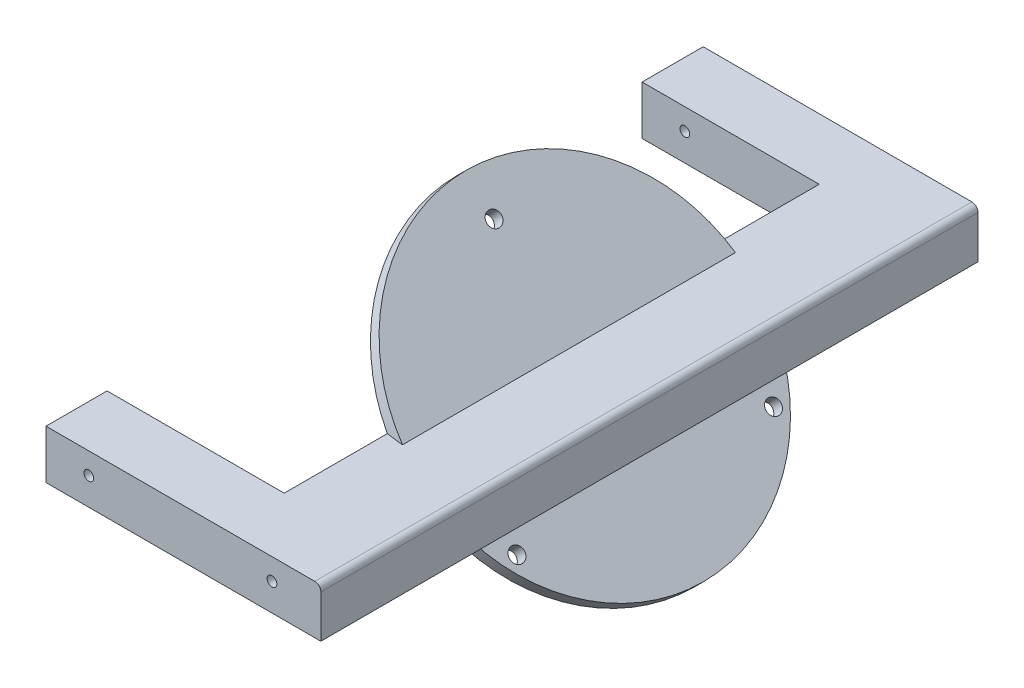
from build123d import *

# Parameters (mm, degrees)
BASE_DEPTH                  = 53.8
SKETCH4_R                   = 27.5
BOSS_EXTRUDE2_DEPTH         = 2
M2_CLEARANCE_HOLE1_D        = 2.4
FILLET1_R                   = 0.5
SIDE_HOLES_D                = 1.6
SIDE_ARM_DEPTH              = 10
TAP_DRILL_FOR_M2X0_4_TAP1_D = 1.6
FILLET2_R                   = 1


with BuildPart() as part:
    # Sketch1 → Base (new, symmetric)
    with BuildSketch(Plane.XY):
        Polygon((8, 4), (-8, 4), (0, -4), (8, -4), align=None)
    extrude(amount=BASE_DEPTH, both=True)

    # Sketch4 → Boss-Extrude2 (add)
    with BuildSketch(Plane(origin=(-2, -2, 0), x_dir=(0, 0, 1), z_dir=(-0.7071067811865475, -0.7071067811865476, 0))):
        with Locations((0, 2.828427125)):
            Circle(SKETCH4_R)
    extrude(amount=-BOSS_EXTRUDE2_DEPTH)

    # M2 Clearance Hole1 (through all)
    with Locations(Plane(origin=(-0.585786438, -0.585786438, 0), x_dir=(0.7071067811865475, -0.7071067811865477, 0), z_dir=(0.7071067811865477, 0.7071067811865475, 0))):
        with Locations((-23.828427125, 0), (11.171572875, 21), (11.171572875, -21)):
            Hole(M2_CLEARANCE_HOLE1_D / 2)

    # Sketch8 → Revolve1 (revolve)
    with BuildSketch(Plane(origin=(-2, 2, 0), x_dir=(0, 0, 1), z_dir=(0.7071067811865437, -0.7071067811865515, 0))):
        with BuildLine():
            Line((0, 3.828427125), (0, 2.828427125))
            Line((0, 2.828427125), (-12, 2.828427125))
            Line((-12, 2.828427125), (-6.5, 10.328427125))
            ThreePointArc((-6.5, 10.328427125), (-4.596194078, 5.732233047), (0, 3.828427125))
        make_face()
    revolve(axis=Axis((-4, 0, 0), (-0.7071067811865515, -0.7071067811865437, 0)))

    # Fillet1
    fillet1_edges = [part.edges().sort_by_distance(p)[0] for p in [
        (-9.303300859, -5.303300859, 6.5),
    ]]
    fillet(fillet1_edges, radius=FILLET1_R)

    # Side Holes (through all)
    with Locations(Plane.XY.offset(53.8)):
        with Locations((0, 0.5)):
            Hole(SIDE_HOLES_D / 2)

    # Sketch9 → Side Arm (add)
    with BuildSketch(Plane.XY.offset(53.8)):
        Polygon((-8, 4), (0, -4), (-37, -4), (-37, 4), align=None)
    side_arm = extrude(amount=-SIDE_ARM_DEPTH)

    # Mirror1: Side Arm across plane
    add(side_arm.mirror(Plane.XY))

    # Tap Drill for M2x0.4 Tap1 (through all)
    with Locations(Plane.XY.offset(53.8)):
        with Locations((-30, 0.5)):
            Hole(TAP_DRILL_FOR_M2X0_4_TAP1_D / 2)

    # Fillet2
    fillet2_edges = [part.edges().sort_by_distance(p)[0] for p in [
        (8, 4, 0),
    ]]
    fillet(fillet2_edges, radius=FILLET2_R)


solid = part.part
